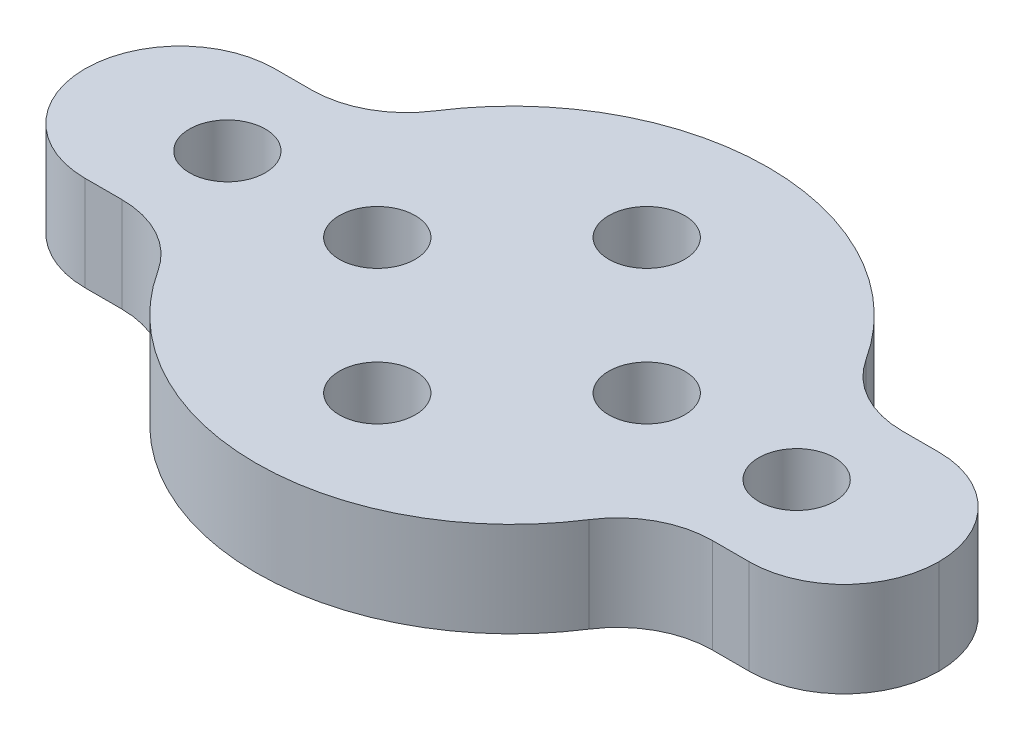
from build123d import *

# Parameters (mm, degrees)
SKETCH1_R           = 2
BOSS_EXTRUDE1_DEPTH = 5
FILLET1_R           = 5
FILLET2_R           = 5
SKETCH3_R           = 3.5
CUT_EXTRUDE2_DEPTH  = 2
CIRPATTERN1_COUNT   = 2
CIRPATTERN1_ANGLE   = 90


with BuildPart() as part:
    # Sketch1 → Boss-Extrude1 (new body)
    with BuildSketch(Plane(origin=(0, 0, 0), x_dir=(1, 0, 0), z_dir=(0, 1, 0))):
        with BuildLine():
            Line((-22.5, 5), (-22.5, -5))
            Line((-22.5, -5), (-12.539936204, -5))
            ThreePointArc((-12.539936204, -5), (0, -13.5), (12.539936204, -5))
            Line((12.539936204, -5), (22.5, -5))
            Line((22.5, -5), (22.5, 5))
            Line((22.5, 5), (12.539936204, 5))
            ThreePointArc((12.539936204, 5), (0, 13.5), (-12.539936204, 5))
            Line((-12.539936204, 5), (-22.5, 5))
        make_face()
        with Locations(Location((15, 0, 0), (0, 0, 270))):
            Circle(SKETCH1_R, mode=Mode.SUBTRACT)
        with Locations(Location((-15, 0, 0), (0, 0, 270))):
            Circle(SKETCH1_R, mode=Mode.SUBTRACT)
        with Locations(Location((-7.1, 0, 0), (0, 0, 270))):
            Circle(SKETCH1_R, mode=Mode.SUBTRACT)
        with Locations(Location((7.1, 0, 0), (0, 0, 270))):
            Circle(SKETCH1_R, mode=Mode.SUBTRACT)
        with Locations(Location((0, -7.1, 0), (0, 0, 270))):
            Circle(SKETCH1_R, mode=Mode.SUBTRACT)
        with Locations(Location((0, 7.1, 0), (0, 0, 270))):
            Circle(SKETCH1_R, mode=Mode.SUBTRACT)
    extrude(amount=BOSS_EXTRUDE1_DEPTH)

    # Fillet1
    fillet1_edges = [part.edges().sort_by_distance(p)[0] for p in [
        (-22.5, 2.5, -5),
        (-22.5, 2.5, 5),
        (22.5, 2.5, 5),
        (22.5, 2.5, -5),
    ]]
    fillet(fillet1_edges, radius=FILLET1_R - 0.0001)  # a hair under: the kernel refuses the full size

    # Fillet2
    fillet2_edges = [part.edges().sort_by_distance(p)[0] for p in [
        (-12.539936204, 2.5, -5),
        (12.539936204, 2.5, -5),
        (12.539936204, 2.5, 5),
        (-12.539936204, 2.5, 5),
    ]]
    fillet(fillet2_edges, radius=FILLET2_R)

    # Sketch3 → Cut-Extrude2 (cut)
    with BuildSketch(Plane.XZ):
        with Locations(Location((-7.1, 0, 0), (0, 0, 270))):
            Circle(SKETCH3_R)
        with Locations(Location((7.1, 0, 0), (0, 0, 270))):
            Circle(SKETCH3_R)
    cut_extrude2 = extrude(amount=-CUT_EXTRUDE2_DEPTH, mode=Mode.SUBTRACT)

    # CirPattern1: Cut-Extrude2 ×2 about axis
    cirpattern1_axis = Axis((0, 0, 0), (0, 1, 0))
    for i in range(1, CIRPATTERN1_COUNT):
        add(cut_extrude2.rotate(cirpattern1_axis, i * CIRPATTERN1_ANGLE / (CIRPATTERN1_COUNT - 1)), mode=Mode.SUBTRACT)


solid = part.part
